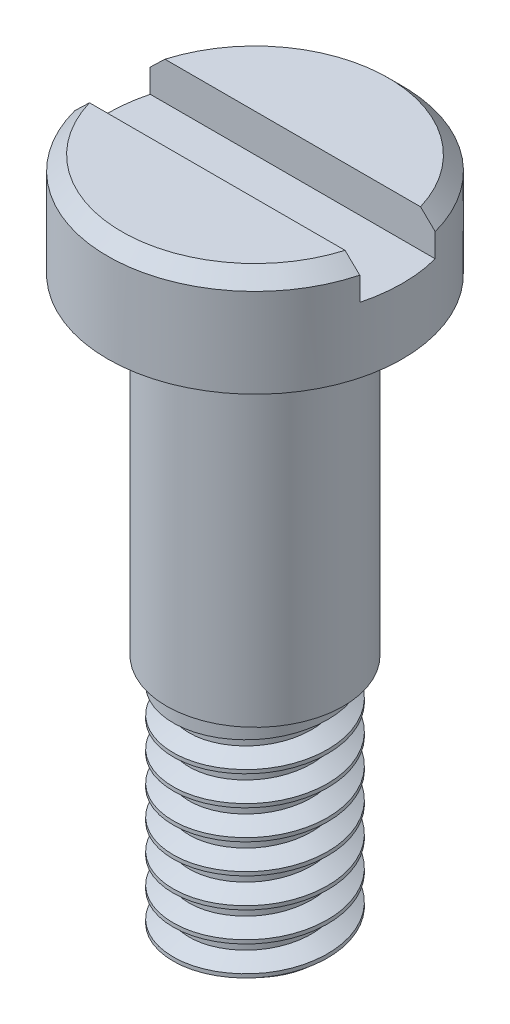
from build123d import *
from build123d.topology import SkipClean

# Parameters (mm, degrees)
SKETCH1_R           = 2.38125
BOSS_EXTRUDE1_DEPTH = 8.89
SKETCH2_R           = 3.96875
BOSS_EXTRUDE2_DEPTH = 2.778125
CHAMFER1_SIZE       = 0.381
SKETCH3_R           = 2.0828
BOSS_EXTRUDE3_DEPTH = 6.35
THREAD1_PITCH       = 0.79375
SKETCH7_W           = 9.355951571
SKETCH7_H           = 2.032
CUT_EXTRUDE1_DEPTH  = 1.016


with BuildPart() as part:
    # Sketch1 → Boss-Extrude1 (new body)
    with BuildSketch(Plane(origin=(0, 0, 0), x_dir=(1, 0, 0), z_dir=(0, 1, 0))):
        with Locations(Location((0, 0, 0), (0, 0, 270))):
            Circle(SKETCH1_R)
    extrude(amount=BOSS_EXTRUDE1_DEPTH)

    # Sketch2 → Boss-Extrude2 (add)
    with BuildSketch(Plane(origin=(0, 8.89, 0), x_dir=(1, 0, 0), z_dir=(0, 1, 0))):
        with Locations(Location((0, 0, 0), (0, 0, 270))):
            Circle(SKETCH2_R)
    extrude(amount=BOSS_EXTRUDE2_DEPTH)

    # Chamfer1
    chamfer1_edges = [part.edges().sort_by_distance(p)[0] for p in [
        (0, 11.668125, -3.96875),
    ]]
    chamfer(chamfer1_edges, length=CHAMFER1_SIZE)

    # Sketch3 → Boss-Extrude3 (add)
    with BuildSketch(Plane.XZ):
        with Locations(Location((0, 0, 0), (0, 0, 270))):
            Circle(SKETCH3_R)
    extrude(amount=BOSS_EXTRUDE3_DEPTH)

    # Thread1: the profile of Thread Profile1 profile screwed along a right-hand helix of 8 turns, 8 arcs to a turn; built about Z, then put on its axis
    with SkipClean():  # the faces are left unmerged after this step: merging them gives an invalid solid
        thread1_z = Axis((0, 0, 0), (0, 0, 1))
        thread1_corners = [(2.0831, 0, -0.000173205), (2.0831, 0, 0.694704453), (1.653170212, 0, 0.446484374), (1.653170212, 0, 0.248046874)]
        with BuildLine(mode=Mode.PRIVATE) as thread1_profile:
            Line(thread1_corners[0], thread1_corners[1])
            Line(thread1_corners[1], thread1_corners[2])
            Line(thread1_corners[2], thread1_corners[3])
            Line(thread1_corners[3], thread1_corners[0])
        thread1_cap = Face(thread1_profile.wire())
        thread1_turn_angles = [0, 22.5, 45, 67.5, 90, 112.5, 135, 157.5, 180, 202.5, 225, 247.5, 270, 292.5, 315, 337.5, 360]
        thread1_turn_weights = [1, 0.9238795325112867, 1, 0.9238795325112867, 1, 0.9238795325112867, 1, 0.9238795325112867, 1, 0.9238795325112867, 1, 0.9238795325112867, 1, 0.9238795325112867, 1, 0.9238795325112867, 1]
        thread1_turn_rails = [Edge.make_bspline([Vector(p[0], p[1], 0).rotate(thread1_z, thread1_turn_angles[k]) / thread1_turn_weights[k] + Vector(0, 0, p[2] + THREAD1_PITCH * thread1_turn_angles[k] / 360) for k in range(17)], [0, 0, 0, 1, 1, 2, 2, 3, 3, 4, 4, 5, 5, 6, 6, 7, 7, 8, 8, 8], 2, thread1_turn_weights) for p in thread1_corners]
        thread1_turn_sides = [Face.make_surface_from_curves(thread1_turn_rails[p[0]], thread1_turn_rails[p[1]]) for p in [(0, 1), (1, 2), (2, 3), (3, 0)]]
        thread1 = Plane(origin=(0, 0, 0), x_dir=(-1, 0, 0), z_dir=(0, -1, 0)) * Solid(Shell([*[p.moved(Location((0, 0, THREAD1_PITCH * i))) for i in range(8) for p in thread1_turn_sides], thread1_cap, thread1_cap.rotate(thread1_z, 2880).moved(Location((0, 0, THREAD1_PITCH * 2880 / 360)))]))
        add(thread1, mode=Mode.SUBTRACT)

    # Sketch7 → Cut-Extrude1 (cut)
    with SkipClean():  # the faces are left unmerged after this step: merging them gives an invalid solid
        with BuildSketch(Plane(origin=(0, 11.668125, 0), x_dir=(1, 0, 0), z_dir=(0, 1, 0))):
            with Locations((0.132789256, 0)):
                Rectangle(SKETCH7_W, SKETCH7_H)
        extrude(amount=-CUT_EXTRUDE1_DEPTH, mode=Mode.SUBTRACT)


solid = part.part
